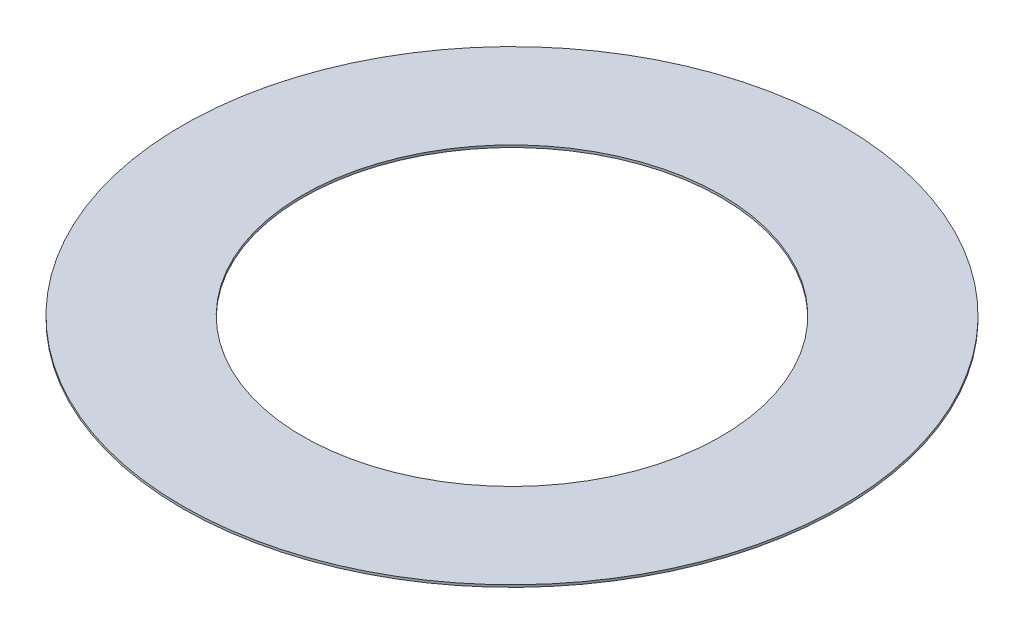
from build123d import *

# Parameters (mm, degrees)
SKETCH1_W = 40
SKETCH1_H = 0.76


with BuildPart() as part:
    # Sketch1 → Revolve1 (revolve)
    with BuildSketch(Plane.XY):
        with Locations((-89.5, 7.7525)):
            Rectangle(SKETCH1_W, SKETCH1_H)
    revolve(axis=Axis((0, -200069.047495165, 0), (0, 1, 0)))


solid = part.part
